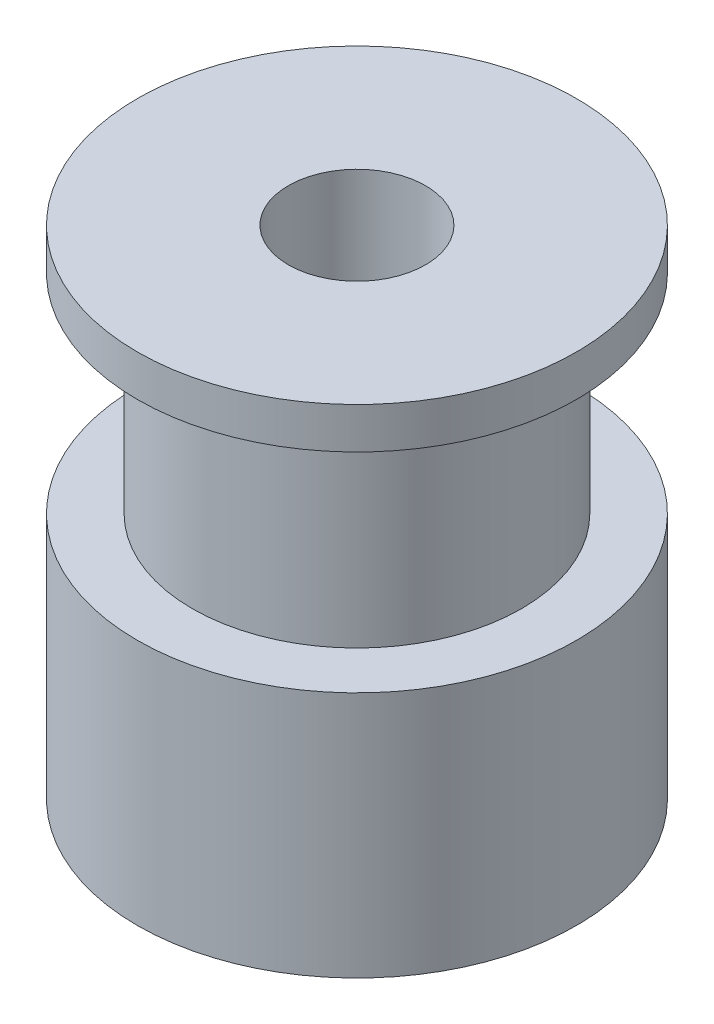
from build123d import *

# Parameters (mm, degrees)
SKETCH1_R           = 8
BOSS_EXTRUDE1_DEPTH = 9
SKETCH2_R           = 6
BOSS_EXTRUDE2_DEPTH = 7.6
SKETCH3_R           = 8
BOSS_EXTRUDE3_DEPTH = 1.5
SKETCH4_R           = 2.5
CUT_EXTRUDE1_DEPTH  = 22.345022839


with BuildPart() as part:
    # Sketch1 → Boss-Extrude1 (new body)
    with BuildSketch(Plane(origin=(0, 0, 0), x_dir=(1, 0, 0), z_dir=(0, 1, 0))):
        Circle(SKETCH1_R)
    extrude(amount=BOSS_EXTRUDE1_DEPTH)

    # Sketch2 → Boss-Extrude2 (add)
    with BuildSketch(Plane(origin=(0, 9, 0), x_dir=(1, 0, 0), z_dir=(0, 1, 0))):
        Circle(SKETCH2_R)
    extrude(amount=BOSS_EXTRUDE2_DEPTH)

    # Sketch3 → Boss-Extrude3 (add)
    with BuildSketch(Plane(origin=(0, 16.6, 0), x_dir=(1, 0, 0), z_dir=(0, 1, 0))):
        Circle(SKETCH3_R)
    extrude(amount=BOSS_EXTRUDE3_DEPTH)

    # Sketch4 → Cut-Extrude1 (cut, through all)
    with BuildSketch(Plane(origin=(0, 18.1, 0), x_dir=(1, 0, 0), z_dir=(0, 1, 0))):
        Circle(SKETCH4_R)
    extrude(amount=-CUT_EXTRUDE1_DEPTH, mode=Mode.SUBTRACT)


solid = part.part
